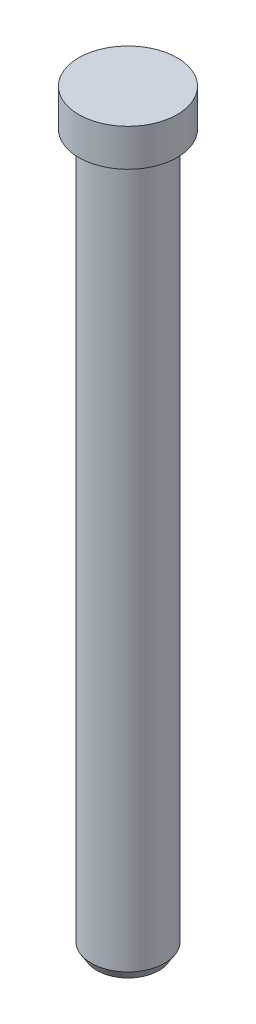
from build123d import *


with BuildPart() as part:
    # Croquis1 → Revolución1 (revolve)
    with BuildSketch(Plane.XY):
        Polygon((0, 60.5), (7.9375, 60.5), (7.9375, 54.5), (5.9375, 54.5), (5.9375, -59), (5, -60.5), (0, -60.5), align=None)
    revolve(axis=Axis((0, 60.5, 0), (0, -1, 0)))


solid = part.part
